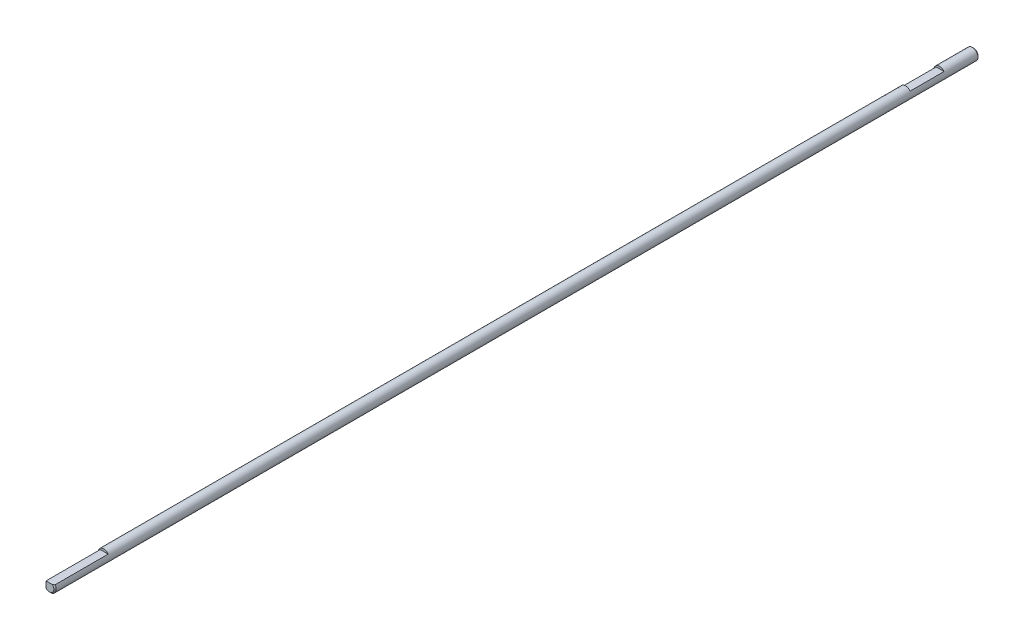
from build123d import *

# Parameters (mm, degrees)
SKETCH_1_R         = 2.5
BODY_DEPTH         = 408.5
CHAMFEREDGES_SIZE  = 0.5
SKETCH2_W          = 15
SKETCH2_H          = 2.50986962
SKETCH2_W_2        = 28
SKETCH2_H_2        = 1.942146438
FIRSTSLOTS_DEPTH   = 409.515299591
ANOTHERSLOTS_COUNT = 2
ANOTHERSLOTS_ANGLE = 90


with BuildPart() as part:
    # Эскиз1 → Body (new body)
    with BuildSketch(Plane.XY):
        Circle(SKETCH_1_R)
    extrude(amount=BODY_DEPTH)

    # ChamferEdges
    chamferedges_edges = [part.edges().sort_by_distance(p)[0] for p in [
        (-2.5, 0, 408.5),
        (-2.5, 0, 0),
    ]]
    chamfer(chamferedges_edges, length=CHAMFEREDGES_SIZE)

    # Sketch2 → FirstSlots (cut, symmetric)
    with BuildSketch(Plane(origin=(0, 0, 0), x_dir=(0, 0, -1), z_dir=(1, 0, 0))):
        with Locations((-22.5, 2.75493481)):
            Rectangle(SKETCH2_W, SKETCH2_H)
        with Locations((-398.5, 2.471073219)):
            Rectangle(SKETCH2_W_2, SKETCH2_H_2)
    firstslots = extrude(amount=FIRSTSLOTS_DEPTH, both=True, mode=Mode.SUBTRACT)

    # AnotherSlots: FirstSlots ×2 about axis
    anotherslots_axis = Axis((0, 0, 408.5), (0, 0, 1))
    for i in range(1, ANOTHERSLOTS_COUNT):
        add(firstslots.rotate(anotherslots_axis, i * ANOTHERSLOTS_ANGLE / (ANOTHERSLOTS_COUNT - 1)), mode=Mode.SUBTRACT)


solid = part.part
